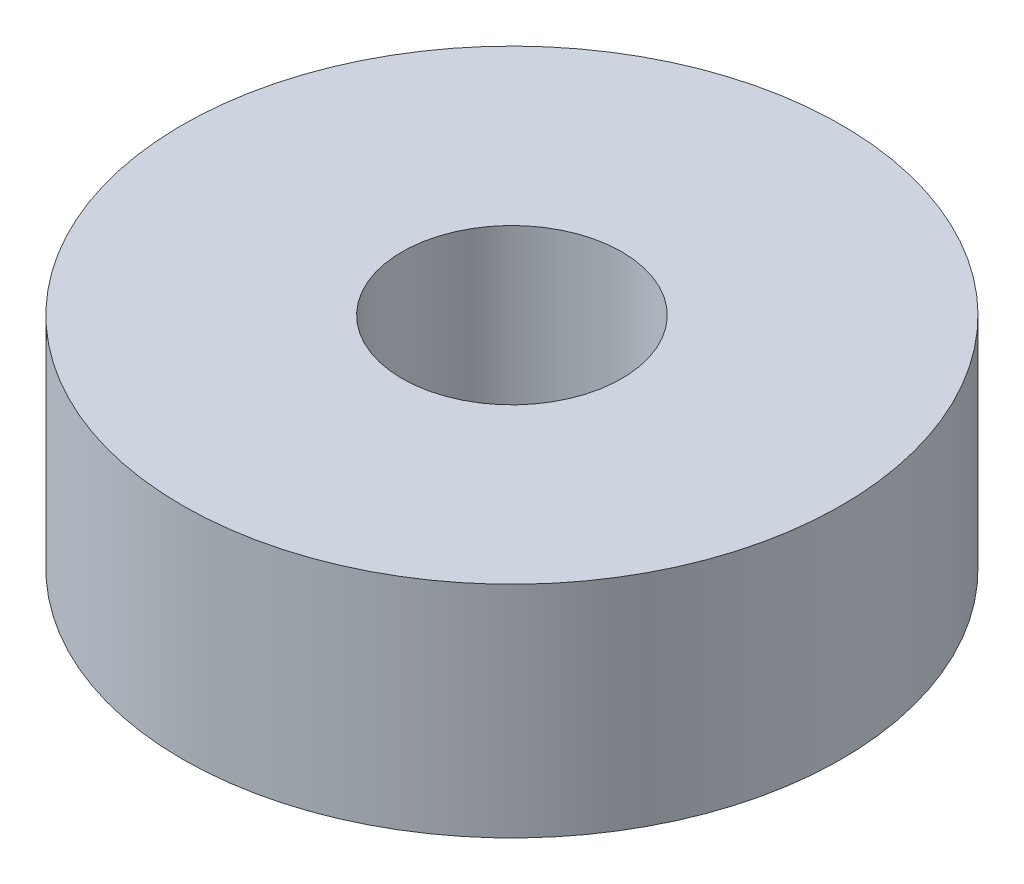
from build123d import *

# Parameters (mm, degrees)
CROQUIS1_R              = 15
CROQUIS1_R_2            = 5
SALIENTE_EXTRUIR1_DEPTH = 10


with BuildPart() as part:
    # Croquis1 → Saliente-Extruir1 (new body)
    with BuildSketch(Plane(origin=(0, 0, 0), x_dir=(1, 0, 0), z_dir=(0, 1, 0))):
        Circle(CROQUIS1_R)
        Circle(CROQUIS1_R_2, mode=Mode.SUBTRACT)
    extrude(amount=SALIENTE_EXTRUIR1_DEPTH)


solid = part.part
